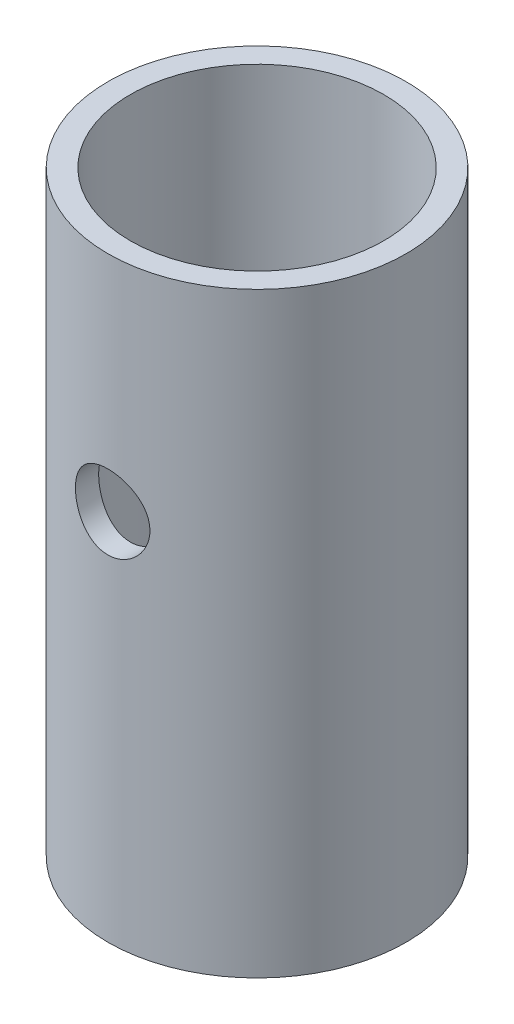
from build123d import *

# Parameters (mm, degrees)
SKETCH1_R               = 5
BOSS_EXTRUDE1_DEPTH     = 20
SKETCH2_R               = 4.25
CUT_EXTRUDE1_DEPTH      = 17.5
SKETCH3_R               = 1.25
CUT_EXTRUDE2_DEPTH      = 2.5
CUT_EXTRUDE3_DEPTH      = 10
CUT_EXTRUDE3_DEPTH_BACK = 10
SKETCH4_R               = 1.25


with BuildPart() as part:
    # Sketch1 → Boss-Extrude1 (new body)
    with BuildSketch(Plane(origin=(0, 0, 0), x_dir=(1, 0, 0), z_dir=(0, 1, 0))):
        Circle(SKETCH1_R)
    extrude(amount=BOSS_EXTRUDE1_DEPTH)

    # Sketch2 → Cut-Extrude1 (cut)
    with BuildSketch(Plane(origin=(0, 20, 0), x_dir=(1, 0, 0), z_dir=(0, 1, 0))):
        Circle(SKETCH2_R)
    extrude(amount=-CUT_EXTRUDE1_DEPTH, mode=Mode.SUBTRACT)

    # Sketch3 → Cut-Extrude2 (cut)
    with BuildSketch(Plane.XZ):
        Circle(SKETCH3_R)
    extrude(amount=-CUT_EXTRUDE2_DEPTH, mode=Mode.SUBTRACT)

    # Sketch4 → Cut-Extrude3 (cut, two sides: drawn at the far end of the back side and taken through both)
    with BuildSketch(Plane.XY.offset(-CUT_EXTRUDE3_DEPTH_BACK)):
        with Locations((0, 12.5)):
            Circle(SKETCH4_R)
    extrude(amount=CUT_EXTRUDE3_DEPTH + CUT_EXTRUDE3_DEPTH_BACK, mode=Mode.SUBTRACT)


solid = part.part
